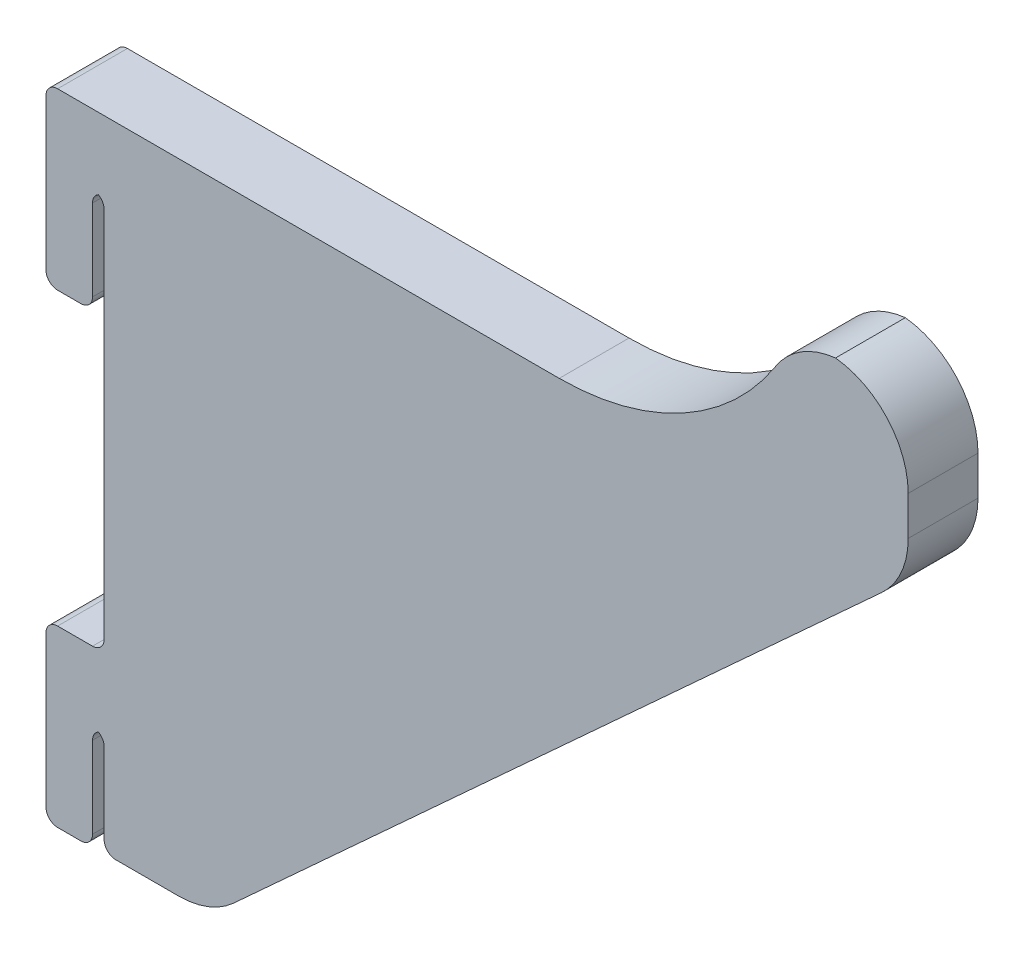
from build123d import *

# Parameters (mm, degrees)
BOSS_EXTRU_1_DEPTH = 3
CONG_3_R           = 1
CONG_4_R           = 7


with BuildPart() as part:
    # Esquisse1 → Boss.-Extru.1 (new, symmetric)
    with BuildSketch(Plane.XY):
        with BuildLine():
            Line((0, 0), (0, 9))
            Line((0, 9), (1, 9))
            Line((1, 9), (1, 0.09638948))
            Line((1, 0.09638948), (10.121873618, 0.09638948))
            Line((10.121873618, 0.09638948), (70.121873618, 55))
            Line((70.121873618, 55), (70.121873618, 68.436194763))
            Line((70.121873618, 68.436194763), (60.432430442, 68.436194763))
            ThreePointArc((60.432430442, 68.436194763), (52.298183077, 58.663045958), (40.121873618, 55))
            Line((40.121873618, 55), (19.293191489, 55))
            Line((19.293191489, 55), (10.121873618, 55))
            Line((10.121873618, 55), (-4, 55))
            Line((-4, 55), (-4, 40))
            Line((-4, 40), (0, 40))
            Line((0, 40), (0, 49))
            Line((0, 49), (1, 49))
            Line((1, 49), (1, 15))
            Line((1, 15), (-4, 15))
            Line((-4, 15), (-4, 0))
            Line((-4, 0), (0, 0))
        make_face()
    extrude(amount=BOSS_EXTRU_1_DEPTH, both=True)

    # Congé3
    # the kernel refuses this fillet: 1 mm, written as the material it adds along each edge
    with BuildSketch(Plane(origin=(1, 9, -3), x_dir=(0, -1, 0), z_dir=(0, 0, 1)), Plane(origin=(1, 15, -3), x_dir=(-1, 0, 0), z_dir=(0, 0, 1)), Plane(origin=(1, 49, -3), x_dir=(0, -1, 0), z_dir=(0, 0, 1)), Plane(origin=(0, 49, -3), x_dir=(1, 0, 0), z_dir=(0, 0, 1))) as cong_3_piece_1:
        with BuildLine():
            CenterArc((CONG_3_R, -CONG_3_R), CONG_3_R, 90, 90)
            Line((0, -CONG_3_R), (0, 0))
            Line((0, 0), (CONG_3_R, 0))
        make_face()
    extrude(amount=6)
    with BuildSketch(Plane(origin=(0, 9, -3), x_dir=(0, -1, 0), z_dir=(0, 0, 1))) as cong_3_piece_2:
        with BuildLine():
            CenterArc((CONG_3_R, CONG_3_R), CONG_3_R, 180, 90)
            Line((0, CONG_3_R), (0, 0))
            Line((0, 0), (CONG_3_R, 0))
        make_face()
    extrude(amount=6)
    # the kernel refuses this fillet: 1 mm, written as the material it takes off along each edge
    with BuildSketch(Plane(origin=(1, 0.09638948, -5.5), x_dir=(0, 1, 0), z_dir=(0, 0, 1)), Plane(origin=(0, 0, 5.5), x_dir=(0, 1, 0), z_dir=(0, 0, -1)), Plane(origin=(-4, 0, 5.5), x_dir=(1, 0, 0), z_dir=(0, 0, -1)), Plane(origin=(-4, 15, 5.5), x_dir=(0, -1, 0), z_dir=(0, 0, -1)), Plane(origin=(0, 40, -5.5), x_dir=(-1, 0, 0), z_dir=(0, 0, 1)), Plane(origin=(-4, 40, -5.5), x_dir=(0, 1, 0), z_dir=(0, 0, 1)), Plane(origin=(-4, 55, -5.5), x_dir=(1, 0, 0), z_dir=(0, 0, 1))) as cong_3_2_piece_1:
        with BuildLine():
            CenterArc((CONG_3_R, -CONG_3_R), CONG_3_R, 90, 90)
            Line((0, -CONG_3_R), (0, 0))
            Line((0, 0), (CONG_3_R, 0))
        make_face()
    extrude(amount=11, mode=Mode.SUBTRACT)

    # Congé4
    # the kernel refuses this fillet: 7 mm, written as the material it takes off along each edge
    with BuildSketch(Plane(origin=(10.121873618, 0.09638948, -9.798414872), x_dir=(-1, 0, 0), z_dir=(0, 0, 1))) as cong_4_piece_1:
        with BuildLine():
            CenterArc((CONG_4_R * 0.388480849828, -CONG_4_R), CONG_4_R, 90, 42.460390035)
            Line((-CONG_4_R * 0.286599498638, -CONG_4_R * 0.262255787474), (0, 0))
            Line((0, 0), (CONG_4_R * 0.388480849828, 0))
        make_face()
    extrude(amount=19.596829744, mode=Mode.SUBTRACT)
    with BuildSketch(Plane(origin=(70.121873618, 55, -10.707405636), x_dir=(-0.7377442125256176, -0.6750803484659854, 0), z_dir=(0, 0, 1))) as cong_4_piece_2:
        with BuildLine():
            CenterArc((CONG_4_R * 0.440423179223, -CONG_4_R), CONG_4_R, 90, 47.539609965)
            Line((-CONG_4_R * 0.297321033302, -CONG_4_R * 0.324919651534), (0, 0))
            Line((0, 0), (CONG_4_R * 0.440423179223, 0))
        make_face()
    extrude(amount=21.414811273, mode=Mode.SUBTRACT)
    with BuildSketch(Plane(origin=(70.121873618, 68.436194763, -20.5), x_dir=(0, -1, 0), z_dir=(0, 0, 1))) as cong_4_piece_3:
        with BuildLine():
            CenterArc((CONG_4_R, -CONG_4_R), CONG_4_R, 90, 90)
            Line((0, -CONG_4_R), (0, 0))
            Line((0, 0), (CONG_4_R, 0))
        make_face()
    extrude(amount=41, mode=Mode.SUBTRACT)
    with BuildSketch(Plane(origin=(60.432430442, 68.436194763, -13.492760312), x_dir=(1, 0, 0), z_dir=(0, 0, 1))) as cong_4_piece_4:
        with BuildLine():
            CenterArc((4.197104125, -7), CONG_4_R, 90, 57.467043301)
            ThreePointArc((-1.704471625, -3.235507515), (-0.785102058, -1.653119949), (0, 0))
            Line((0, 0), (4.197104125, 0))
        make_face()
    extrude(amount=26.985520624, mode=Mode.SUBTRACT)


solid = part.part
